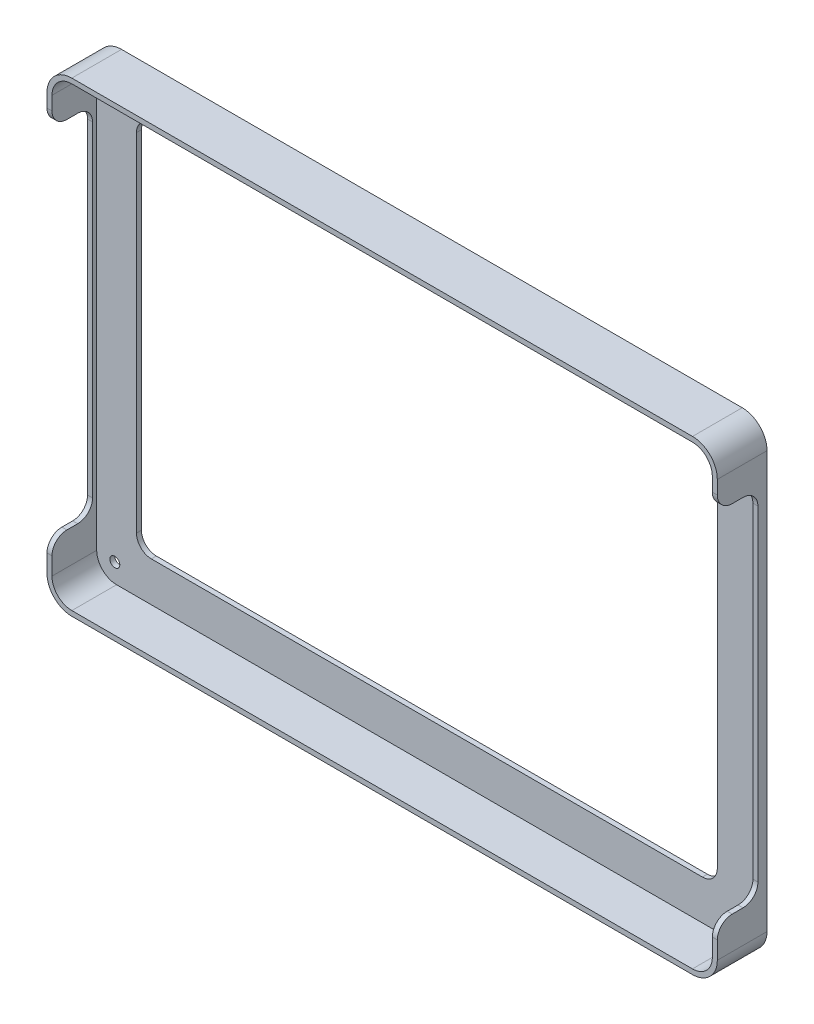
from build123d import *

# Parameters (mm, degrees)
BOSS_EXTRUDE1_DEPTH = 10
SKETCH2_R           = 1
SKETCH2_W           = 116.84899
SKETCH2_H           = 75.7696
BOSS_EXTRUDE2_DEPTH = 1
CAVITY1_START       = 1.833256049
CAVITY1_OUTLINE_W   = 1
CAVITY1_OUTLINE_H   = 71.506597146
CAVITY1_DEPTH       = 8.166743951
FILLET1_R           = 3
FILLET2_R           = 3
FILLET3_R           = 3


# Read off the part's stored shape, not the designer's step: Cavity1
with BuildPart() as part:
    # Sketch1 → Boss-Extrude1 (new body)
    with BuildSketch(Plane.XY):
        with BuildLine():
            Line((-67.723179308, 39.023349276), (57.135904391, 39.023349276))
            ThreePointArc((57.135904391, 39.023349276), (60.664300974, 37.561839558), (62.125810692, 34.033442975))
            Line((62.125810692, 34.033442975), (62.125810692, -49.746250724))
            ThreePointArc((62.125810692, -49.746250724), (60.661344598, -53.28178463), (57.125810692, -54.746250724))
            Line((57.125810692, -54.746250724), (-67.723179308, -54.746250724))
            ThreePointArc((-67.723179308, -54.746250724), (-71.258713213, -53.28178463), (-72.723179308, -49.746250724))
            Line((-72.723179308, -49.746250724), (-72.723179308, 34.023349276))
            ThreePointArc((-72.723179308, 34.023349276), (-71.258713213, 37.558883182), (-67.723179308, 39.023349276))
        make_face()
        with BuildLine():
            Line((-67.723179308, 38.023349276), (57.135904391, 38.023349276))
            ThreePointArc((57.135904391, 38.023349276), (59.957194193, 36.854732777), (61.125810692, 34.033442975))
            Line((61.125810692, 34.033442975), (61.125810692, -49.746250724))
            ThreePointArc((61.125810692, -49.746250724), (59.954237817, -52.574677849), (57.125810692, -53.746250724))
            Line((57.125810692, -53.746250724), (-67.723179308, -53.746250724))
            ThreePointArc((-67.723179308, -53.746250724), (-70.551606432, -52.574677849), (-71.723179308, -49.746250724))
            Line((-71.723179308, -49.746250724), (-71.723179308, 34.023349276))
            ThreePointArc((-71.723179308, 34.023349276), (-70.551606432, 36.851776401), (-67.723179308, 38.023349276))
        make_face(mode=Mode.SUBTRACT)
    extrude(amount=BOSS_EXTRUDE1_DEPTH)

    # Sketch2 → Boss-Extrude2 (add)
    with BuildSketch(Plane.XY):
        with BuildLine():
            Line((-67.723179308, 38.023349276), (57.135904391, 38.023349276))
            ThreePointArc((57.135904391, 38.023349276), (59.957194193, 36.854732777), (61.125810692, 34.033442975))
            Line((61.125810692, 34.033442975), (61.125810692, -49.746250724))
            ThreePointArc((61.125810692, -49.746250724), (59.954237817, -52.574677849), (57.125810692, -53.746250724))
            Line((57.125810692, -53.746250724), (-67.723179308, -53.746250724))
            ThreePointArc((-67.723179308, -53.746250724), (-70.551606432, -52.574677849), (-71.723179308, -49.746250724))
            Line((-71.723179308, -49.746250724), (-71.723179308, 34.023349276))
            ThreePointArc((-71.723179308, 34.023349276), (-70.551606432, 36.851776401), (-67.723179308, 38.023349276))
        make_face()
        with Locations((-67.798179308, 34.314149276)):
            Circle(SKETCH2_R, mode=Mode.SUBTRACT)
        with Locations((-68.073179308, -49.962350724)):
            Circle(SKETCH2_R, mode=Mode.SUBTRACT)
        with Locations((57.254910692, -50.238050724)):
            Circle(SKETCH2_R, mode=Mode.SUBTRACT)
        with Locations((57.530010692, 34.311649276)):
            Circle(SKETCH2_R, mode=Mode.SUBTRACT)
        with Locations((-5.298684308, -7.861450724)):
            Rectangle(SKETCH2_W, SKETCH2_H, mode=Mode.SUBTRACT)
    extrude(amount=BOSS_EXTRUDE2_DEPTH)

    # Cavity1 outline → Cavity1 (cut)
    with BuildSketch(Plane.XY.offset(CAVITY1_START)):
        with Locations((61.625810692, -7.448622115)):
            Rectangle(CAVITY1_OUTLINE_W, CAVITY1_OUTLINE_H)
        with Locations((-72.223179308, -7.448622115)):
            Rectangle(CAVITY1_OUTLINE_W, CAVITY1_OUTLINE_H)
    extrude(amount=CAVITY1_DEPTH, mode=Mode.SUBTRACT)

    # Fillet1
    fillet1_edges = [part.edges().sort_by_distance(p)[0] for p in [
        (61.625810692, -43.201920688, 10),
        (-72.223179308, -43.201920688, 10),
        (-72.223179308, 28.304676458, 10),
        (61.625810692, 28.304676458, 10),
    ]]
    fillet(fillet1_edges, radius=FILLET1_R)

    # Fillet2
    fillet2_edges = [part.edges().sort_by_distance(p)[0] for p in [
        (-72.223179308, -43.201920688, 1.833256049),
        (-72.223179308, 28.304676458, 1.833256049),
        (61.625810692, -43.201920688, 1.833256049),
        (61.625810692, 28.304676458, 1.833256049),
    ]]
    fillet(fillet2_edges, radius=FILLET2_R)

    # Fillet3
    fillet3_edges = [part.edges().sort_by_distance(p)[0] for p in [
        (-63.723179308, -45.746250724, 0.5),
        (53.125810692, -45.746250724, 0.5),
        (53.125810692, 30.023349276, 0.5),
        (-63.723179308, 30.023349276, 0.5),
    ]]
    fillet(fillet3_edges, radius=FILLET3_R)


solid = part.part
